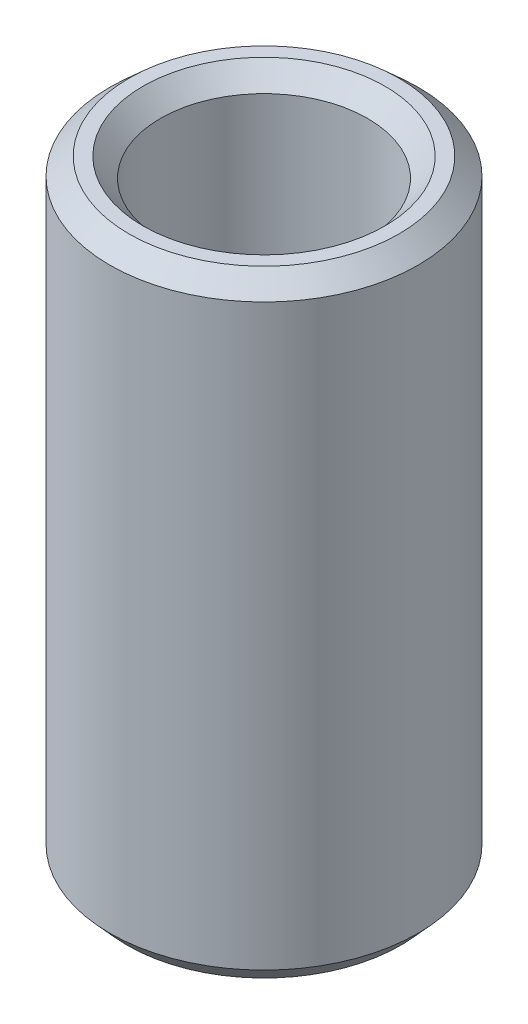
from build123d import *
from OCP.BRepFilletAPI import BRepFilletAPI_MakeChamfer

# Parameters (mm, degrees)
SKETCH1_R           = 30
BOSS_EXTRUDE1_DEPTH = 119.736719964
SKETCH2_R           = 20.168194295
CUT_EXTRUDE1_DEPTH  = 128.03102813
CHAMFER1_SIZE       = 3.390414968
CHAMFER1_SIZE2      = 3.735025575


with BuildPart() as part:
    # Sketch1 → Boss-Extrude1 (new body)
    with BuildSketch(Plane(origin=(0, 0, 0), x_dir=(1, 0, 0), z_dir=(0, 1, 0))):
        Circle(SKETCH1_R)
    extrude(amount=BOSS_EXTRUDE1_DEPTH)

    # Sketch2 → Cut-Extrude1 (cut, through all)
    with BuildSketch(Plane(origin=(0, 0, 0), x_dir=(1, 0, 0), z_dir=(0, 1, 0))):
        Circle(SKETCH2_R)
    extrude(amount=CUT_EXTRUDE1_DEPTH, mode=Mode.SUBTRACT)

    # Chamfer1: one chamfer whose edges measure the first distance from different faces: ONE call of the kernel's chamfer builder (chamfer() names one face for all edges)
    chamfer1_edges_1 = [part.edges().sort_by_distance(p)[0] for p in [
        (-20.168194295, 119.736719964, 0),
    ]]
    chamfer1_side_1 = [part.faces().sort_by_distance(p)[0] for p in [
        (-29.151471863, 119.736719964, 0),
    ]]
    chamfer1_edges_2 = [part.edges().sort_by_distance(p)[0] for p in [
        (-20.168194295, 0, 0),
    ]]
    chamfer1_side_2 = [part.faces().sort_by_distance(p)[0] for p in [
        (-20.168194295, 59.868359982, 0),
    ]]
    chamfer1_edges_3 = [part.edges().sort_by_distance(p)[0] for p in [
        (-30, 0, 0),
    ]]
    chamfer1_side_3 = [part.faces().sort_by_distance(p)[0] for p in [
        (-29.151471863, 0, 0),
    ]]
    chamfer1_edges_4 = [part.edges().sort_by_distance(p)[0] for p in [
        (-30, 119.736719964, 0),
    ]]
    chamfer1_side_4 = [part.faces().sort_by_distance(p)[0] for p in [
        (-30, 59.868359982, 0),
    ]]
    chamfer1 = BRepFilletAPI_MakeChamfer(part.part.solid().wrapped)
    for e in chamfer1_edges_1:
        chamfer1.Add(CHAMFER1_SIZE, CHAMFER1_SIZE2, e.wrapped, chamfer1_side_1[0].wrapped)  # the first distance lies on this face
    for e in chamfer1_edges_2:
        chamfer1.Add(CHAMFER1_SIZE, CHAMFER1_SIZE2, e.wrapped, chamfer1_side_2[0].wrapped)  # the first distance lies on this face
    for e in chamfer1_edges_3:
        chamfer1.Add(CHAMFER1_SIZE, CHAMFER1_SIZE2, e.wrapped, chamfer1_side_3[0].wrapped)  # the first distance lies on this face
    for e in chamfer1_edges_4:
        chamfer1.Add(CHAMFER1_SIZE, CHAMFER1_SIZE2, e.wrapped, chamfer1_side_4[0].wrapped)  # the first distance lies on this face
    add(Compound.cast(chamfer1.Shape()), mode=Mode.REPLACE)


solid = part.part
